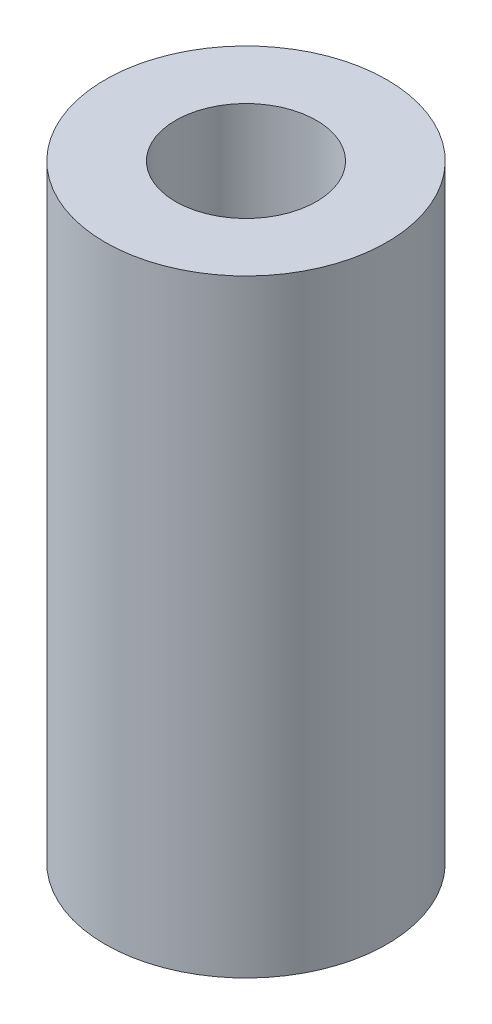
from build123d import *

# Parameters (mm, degrees)
SKETCH1_R           = 3
SKETCH1_R_2         = 1.5
BOSS_EXTRUDE1_DEPTH = 6.474


with BuildPart() as part:
    # Sketch1 → Boss-Extrude1 (new, symmetric)
    with BuildSketch(Plane(origin=(0, 0, 0), x_dir=(1, 0, 0), z_dir=(0, 1, 0))):
        Circle(SKETCH1_R)
        Circle(SKETCH1_R_2, mode=Mode.SUBTRACT)
    extrude(amount=BOSS_EXTRUDE1_DEPTH, both=True)


solid = part.part
